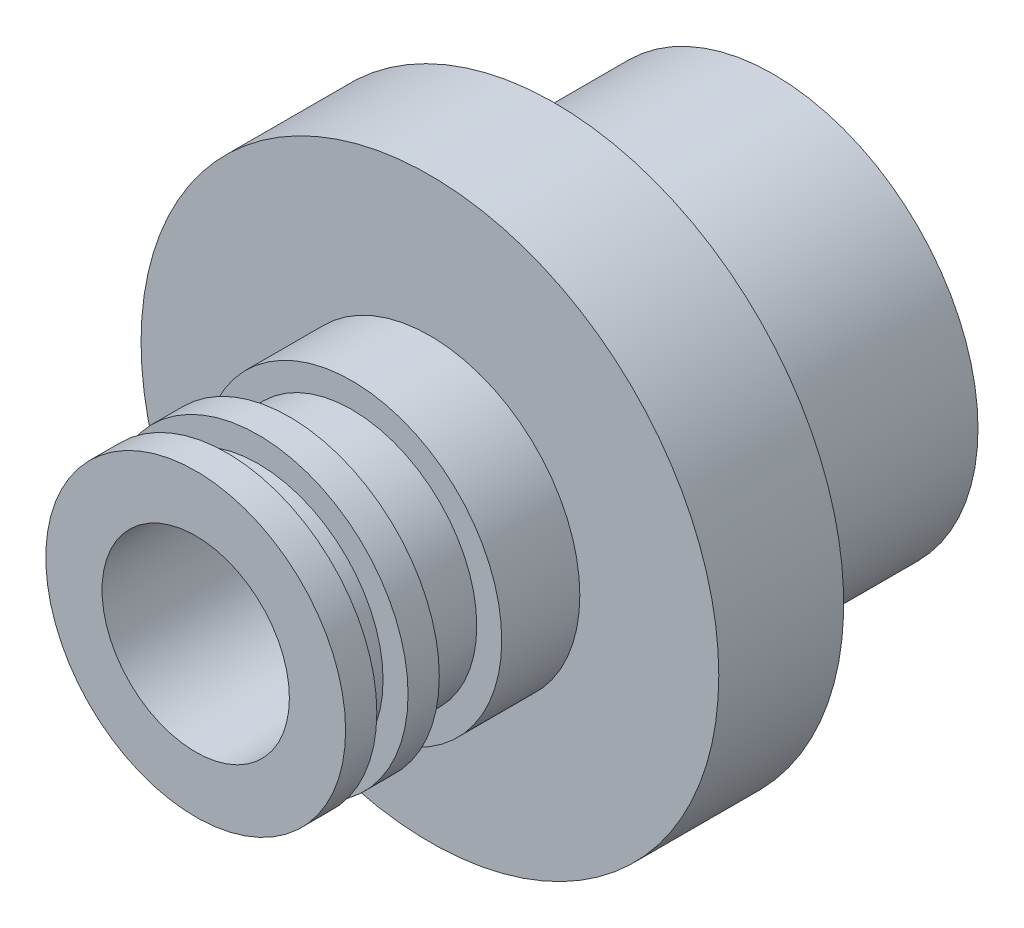
from build123d import *

# Parameters (mm, degrees)
SKETCH1_R           = 9.25
SKETCH1_R_2         = 3
BOSS_EXTRUDE1_DEPTH = 18.5
SKETCH2_OUTSIDE_W   = 26.908
SKETCH2_OUTSIDE_H   = 26.908
SKETCH2_OUTSIDE_R   = 4.8
CUT_EXTRUDE1_DEPTH  = 7.5
CUT_EXTRUDE2_START  = -1
SKETCH3_OUTSIDE_W   = 26.908
SKETCH3_OUTSIDE_H   = 26.908
SKETCH3_OUTSIDE_R   = 4
CUT_EXTRUDE2_DEPTH  = 1
CUT_EXTRUDE3_START  = -3
SKETCH3_2_OUTSIDE_W = 26.908
SKETCH3_2_OUTSIDE_H = 26.908
SKETCH3_2_OUTSIDE_R = 4
CUT_EXTRUDE3_DEPTH  = 2
SKETCH4_OUTSIDE_W   = 26.908
SKETCH4_OUTSIDE_H   = 26.908
SKETCH4_OUTSIDE_R   = 6.55
CUT_EXTRUDE4_DEPTH  = 7


with BuildPart() as part:
    # Sketch1 → Boss-Extrude1 (new body)
    with BuildSketch(Plane.XY):
        Circle(SKETCH1_R)
        Circle(SKETCH1_R_2, mode=Mode.SUBTRACT)
    extrude(amount=BOSS_EXTRUDE1_DEPTH)

    # Sketch2 outside → Cut-Extrude1 (cut)
    with BuildSketch(Plane.XY.offset(18.5)):
        Rectangle(SKETCH2_OUTSIDE_W, SKETCH2_OUTSIDE_H)
        Circle(SKETCH2_OUTSIDE_R, mode=Mode.SUBTRACT)
    extrude(amount=-CUT_EXTRUDE1_DEPTH, mode=Mode.SUBTRACT)

    # Sketch3 outside → Cut-Extrude2 (cut)
    with BuildSketch(Plane.XY.offset(18.5).offset(CUT_EXTRUDE2_START)):
        Rectangle(SKETCH3_OUTSIDE_W, SKETCH3_OUTSIDE_H)
        Circle(SKETCH3_OUTSIDE_R, mode=Mode.SUBTRACT)
    extrude(amount=-CUT_EXTRUDE2_DEPTH, mode=Mode.SUBTRACT)

    # Sketch3<2> outside → Cut-Extrude3 (cut)
    with BuildSketch(Plane.XY.offset(18.5).offset(CUT_EXTRUDE3_START)):
        Rectangle(SKETCH3_2_OUTSIDE_W, SKETCH3_2_OUTSIDE_H)
        Circle(SKETCH3_2_OUTSIDE_R, mode=Mode.SUBTRACT)
    extrude(amount=-CUT_EXTRUDE3_DEPTH, mode=Mode.SUBTRACT)

    # Sketch4 outside → Cut-Extrude4 (cut)
    with BuildSketch(Plane(origin=(0, 0, 0), x_dir=(-1, 0, 0), z_dir=(0, 0, -1))):
        Rectangle(SKETCH4_OUTSIDE_W, SKETCH4_OUTSIDE_H)
        Circle(SKETCH4_OUTSIDE_R, mode=Mode.SUBTRACT)
    extrude(amount=-CUT_EXTRUDE4_DEPTH, mode=Mode.SUBTRACT)


solid = part.part
